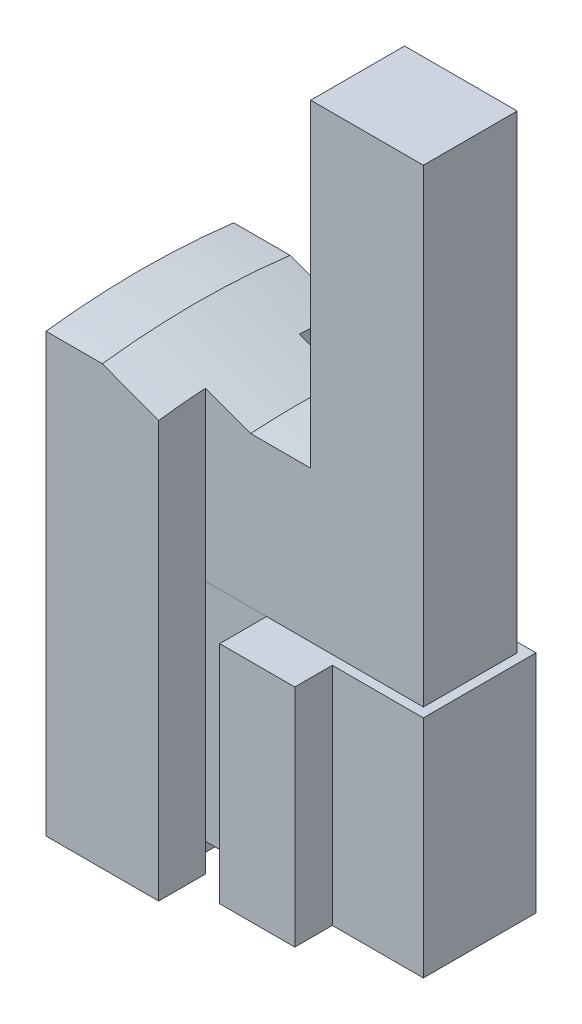
from build123d import *

# Parameters (mm, degrees)
MHSL3_50D_MHSL_FINGER_START       = -14.5
MHSL3_50D_MHSL_FINGER_OUTLINE_W   = 24
MHSL3_50D_MHSL_FINGER_OUTLINE_H   = 10
MHSL3_50D_MHSL_FINGER_OUTLINE_R   = 2.5
MHSL3_50D_MHSL_FINGER_DEPTH       = 24.2
MHSL3_50D_MHSL_FINGER_START_2     = -8
MHSL3_50D_MHSL_FINGER_2_OUTLINE_W = 24
MHSL3_50D_MHSL_FINGER_2_OUTLINE_H = 5
MHSL3_50D_MHSL_FINGER_2_DEPTH     = 8
MHSL3_50D_MHSL_FINGER_START_3     = -6.5
MHSL3_50D_MHSL_FINGER_3_OUTLINE_W = 24
MHSL3_50D_MHSL_FINGER_3_OUTLINE_H = 1
MHSL3_50D_MHSL_FINGER_3_OUTLINE_R = 2.5
MHSL3_50D_MHSL_FINGER_3_DEPTH     = 16.2
MHSL3_50D_MHSL_FINGER_START_4     = -16.5
MHSL3_50D_MHSL_FINGER_4_OUTLINE_W = 10
MHSL3_50D_MHSL_FINGER_4_OUTLINE_H = 10
MHSL3_50D_MHSL_FINGER_4_OUTLINE_R = 2.5
MHSL3_50D_MHSL_FINGER_4_DEPTH     = 2
BOSS_EXTRUDE2_DEPTH               = 5
BOSS_EXTRUDE2_DEPTH_BACK          = 5
CBORE_FOR_M5_SHCS5_AT_2_COUNT     = 2
CBORE_FOR_M5_SHCS5_AT_2_PITCH     = 14
BOSS_EXTRUDE3_DEPTH               = 10
BOSS_EXTRUDE4_DEPTH               = 5
SKETCH18_W                        = 10
SKETCH18_H                        = 20
BOSS_EXTRUDE5_DEPTH               = 3
SKETCH21_W                        = 5
SKETCH21_H                        = 13
BOSS_EXTRUDE7_DEPTH               = 2


# Read off the part's stored shape, not the designer's step: MHSL3-50D_MHSL-Finger
with BuildPart() as part:
    # MHSL3-50D_MHSL-Finger outline → MHSL3-50D_MHSL-Finger (new body)
    with BuildSketch(Plane.YZ.offset(MHSL3_50D_MHSL_FINGER_START)):
        Rectangle(MHSL3_50D_MHSL_FINGER_OUTLINE_W, MHSL3_50D_MHSL_FINGER_OUTLINE_H)
        with Locations((7, 0)):
            Circle(MHSL3_50D_MHSL_FINGER_OUTLINE_R, mode=Mode.SUBTRACT)
        with Locations((-7, 0)):
            Circle(MHSL3_50D_MHSL_FINGER_OUTLINE_R, mode=Mode.SUBTRACT)
    extrude(amount=MHSL3_50D_MHSL_FINGER_DEPTH)



with BuildPart() as body_2:
    # MHSL3-50D_MHSL-Finger 2 outline → MHSL3-50D_MHSL-Finger 2 (new body)
    with BuildSketch(Plane.YZ.offset(MHSL3_50D_MHSL_FINGER_START_2)):
        with Locations((0, 7.5)):
            Rectangle(MHSL3_50D_MHSL_FINGER_2_OUTLINE_W, MHSL3_50D_MHSL_FINGER_2_OUTLINE_H)
        with Locations((0, -7.5)):
            Rectangle(MHSL3_50D_MHSL_FINGER_2_OUTLINE_W, MHSL3_50D_MHSL_FINGER_2_OUTLINE_H)
    extrude(amount=MHSL3_50D_MHSL_FINGER_2_DEPTH)


with BuildPart() as part_1:
    add(part.part)

    add(body_2.part)  # MHSL3-50D_MHSL-Finger 3 merges body 2
    # MHSL3-50D_MHSL-Finger 3 outline → MHSL3-50D_MHSL-Finger 3 (add)
    with BuildSketch(Plane.YZ.offset(MHSL3_50D_MHSL_FINGER_START_3)):
        with Locations((0, 5.5)):
            Rectangle(MHSL3_50D_MHSL_FINGER_3_OUTLINE_W, MHSL3_50D_MHSL_FINGER_3_OUTLINE_H)
        with Locations((0, -5.5)):
            Rectangle(MHSL3_50D_MHSL_FINGER_3_OUTLINE_W, MHSL3_50D_MHSL_FINGER_3_OUTLINE_H)
        with Locations((7, 0)):
            Circle(MHSL3_50D_MHSL_FINGER_3_OUTLINE_R)
        with Locations((-7, 0)):
            Circle(MHSL3_50D_MHSL_FINGER_3_OUTLINE_R)
    extrude(amount=MHSL3_50D_MHSL_FINGER_3_DEPTH)

    # MHSL3-50D_MHSL-Finger 4 outline → MHSL3-50D_MHSL-Finger 4 (add)
    # profile 1 of 2: a face of its own
    with BuildSketch(Plane.YZ.offset(MHSL3_50D_MHSL_FINGER_START_4)):
        with Locations((7, 0)):
            Rectangle(MHSL3_50D_MHSL_FINGER_4_OUTLINE_W, MHSL3_50D_MHSL_FINGER_4_OUTLINE_H)
        with Locations((7, 0)):
            Circle(MHSL3_50D_MHSL_FINGER_4_OUTLINE_R, mode=Mode.SUBTRACT)
    # profile 2 of 2: a face of its own
    with BuildSketch(Plane.YZ.offset(MHSL3_50D_MHSL_FINGER_START_4)):
        with Locations((-7, 0)):
            Rectangle(MHSL3_50D_MHSL_FINGER_4_OUTLINE_W, MHSL3_50D_MHSL_FINGER_4_OUTLINE_H)
        with Locations((-7, 0)):
            Circle(MHSL3_50D_MHSL_FINGER_4_OUTLINE_R, mode=Mode.SUBTRACT)
    extrude(amount=MHSL3_50D_MHSL_FINGER_4_DEPTH)


with BuildPart() as body_2_2:
    # Sketch2 → Boss-Extrude2 (new, two sides: drawn at the far end of the back side and taken through both)
    with BuildSketch(Plane.XY.offset(-BOSS_EXTRUDE2_DEPTH_BACK)):
        Polygon((-16.5, -4.5), (-16.5, -2), (-14.5, -2), (-14.5, 2), (-16.5, 2), (-16.5, 4.5), (-16.5, 9.5), (-16.5, 12), (8.7, 12), (8.7, 61.989999), (-3.3, 61.989999), (-3.3, 28.2), (-26.5, 28.2), (-26.5, -12), (-16.5, -12), (-16.5, -9.5), align=None)
    extrude(amount=BOSS_EXTRUDE2_DEPTH + BOSS_EXTRUDE2_DEPTH_BACK)

    # Sketch14 → CBORE for M5 SHCS5 (revolve, cut)
    with BuildSketch(Plane(origin=(-26.5, 7, 0), x_dir=(0, 0, 1), z_dir=(0, 1, 0))):
        Polygon((0, 0), (0, 36.2), (2.75, 36.2), (2.75, 5.5), (4.5, 5.5), (4.5, 0), align=None)
    cbore_for_m5_shcs5 = revolve(axis=Axis((-32.85, 7, 0), (1, 0, 0)), mode=Mode.SUBTRACT)

    # CBORE for M5 SHCS5 at 2: CBORE for M5 SHCS5 ×2
    with Locations(*[(0, -i * CBORE_FOR_M5_SHCS5_AT_2_PITCH, 0) for i in range(1, CBORE_FOR_M5_SHCS5_AT_2_COUNT)]):
        add(cbore_for_m5_shcs5, mode=Mode.SUBTRACT)

    # Sketch15 → Boss-Extrude3 (add)
    with BuildSketch(Plane(origin=(0, 0, -5), x_dir=(-1, 0, 0), z_dir=(0, 0, -1))):
        Polygon((26.5, 28.2), (26.5, 32.2), (20.5, 32.2), (9.7, 28.2), align=None)
    extrude(amount=-BOSS_EXTRUDE3_DEPTH)

    # Sketch16 → Boss-Extrude4 (add)
    with BuildSketch(Plane(origin=(0, 0, -5), x_dir=(-1, 0, 0), z_dir=(0, 0, -1))):
        Polygon((26.5, -12), (16.5, -12), (16.5, -2), (14.5, -2), (14.5, 2), (16.5, 2), (16.5, 12), (16.5, 30.718518519), (20.5, 32.2), (26.5, 32.2), align=None)
    boss_extrude4 = extrude(amount=BOSS_EXTRUDE4_DEPTH)

    # Mirror1: Boss-Extrude4 across plane
    add(boss_extrude4.mirror(Plane.XY))

    # Sketch18 → Boss-Extrude5 (add)
    with BuildSketch(Plane.XZ.offset(12)):
        with Locations((-21.5, 0)):
            Rectangle(SKETCH18_W, SKETCH18_H)
    extrude(amount=BOSS_EXTRUDE5_DEPTH)

    # Sketch21 → Boss-Extrude7 (add)
    with BuildSketch(Plane(origin=(-16.5, 0, 0), x_dir=(0, 0, -1), z_dir=(1, 0, 0))):
        Polygon((-5, 30.718518519), (-10, 30.718518519), (-10, 2), (-5, 2), (-5, 12), align=None)
        Polygon((5, 12), (5, 2), (10, 2), (10, 30.718518519), (5, 30.718518519), align=None)
        with Locations((7.5, -8.5)):
            Rectangle(SKETCH21_W, SKETCH21_H)
        with Locations((-7.5, -8.5)):
            Rectangle(SKETCH21_W, SKETCH21_H)
    extrude(amount=BOSS_EXTRUDE7_DEPTH)

    # Sketch17 → Cut-Revolve1 (revolve, cut)
    with BuildSketch(Plane.XY):
        Polygon((-9.7, 28.2), (-20.5, 32.2), (-26.5, 32.2), (-26.5, 48.976180053), (-3.3, 48.976180053), (-3.3, 28.2), align=None)
    revolve(axis=Axis((-3.3, -48, 0), (-1, 0, 0)), mode=Mode.SUBTRACT)


solid = Compound([part_1.part, body_2_2.part])
